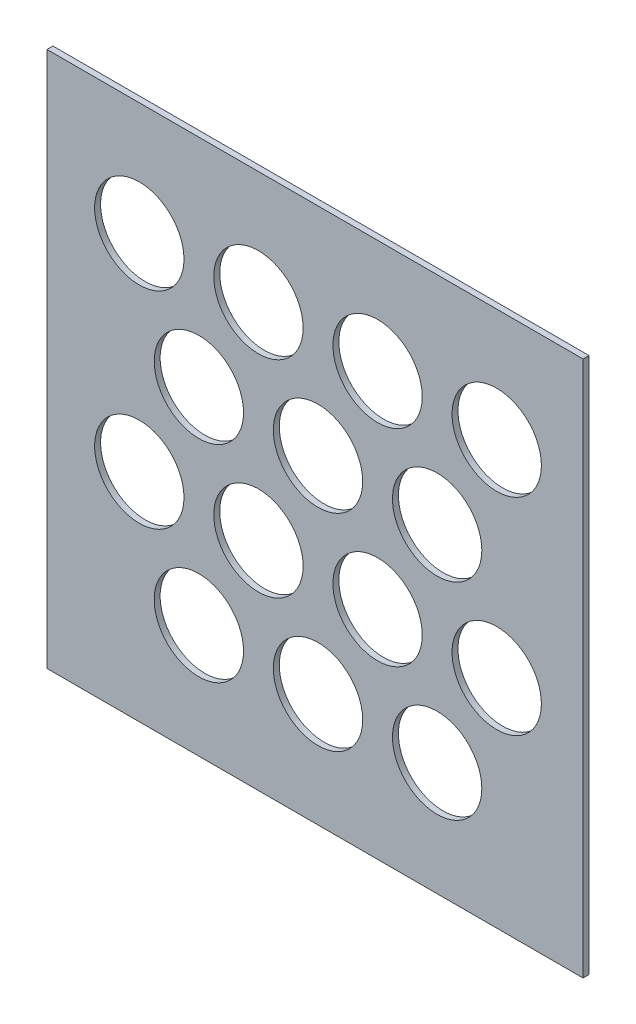
from build123d import *

# Parameters (mm, degrees)
SKETCH1_W               = 228.6
SKETCH1_H               = 228.6
BOSS_EXTRUDE1_DEPTH     = 2.54
SKETCH4_R               = 19.05
CUT_EXTRUDE2_DEPTH      = 378.179309613
FILL_PATTERN2_OUTLINE_R = 19.05
FILL_PATTERN2_DEPTH     = 2.54


# Read off the part's stored shape, not the designer's step: Fill Pattern2
with BuildPart() as part:
    # Sketch1 → Boss-Extrude1 (new body)
    with BuildSketch(Plane.XY):
        with Locations((-152.4, 152.4)):
            Rectangle(SKETCH1_W, SKETCH1_H)
    extrude(amount=BOSS_EXTRUDE1_DEPTH)

    # Sketch4 → Cut-Extrude2 (cut, through all)
    with BuildSketch(Plane.XY):
        with Locations((-227.33, 218.44)):
            Circle(SKETCH4_R)
    extrude(amount=CUT_EXTRUDE2_DEPTH, mode=Mode.SUBTRACT)

    # Fill Pattern2 outline → Fill Pattern2 (cut)
    with BuildSketch(Plane.XY):
        with Locations((-74.93, 130.451818976)):
            Circle(FILL_PATTERN2_OUTLINE_R)
        with Locations((-201.93, 86.457728463)):
            Circle(FILL_PATTERN2_OUTLINE_R)
        with Locations((-176.53, 218.44)):
            Circle(FILL_PATTERN2_OUTLINE_R)
        with Locations((-201.93, 174.445909488)):
            Circle(FILL_PATTERN2_OUTLINE_R)
        with Locations((-227.33, 130.451818976)):
            Circle(FILL_PATTERN2_OUTLINE_R)
        with Locations((-125.73, 130.451818976)):
            Circle(FILL_PATTERN2_OUTLINE_R)
        with Locations((-100.33, 174.445909488)):
            Circle(FILL_PATTERN2_OUTLINE_R)
        with Locations((-74.93, 218.44)):
            Circle(FILL_PATTERN2_OUTLINE_R)
        with Locations((-100.33, 86.457728463)):
            Circle(FILL_PATTERN2_OUTLINE_R)
        with Locations((-176.53, 130.451818976)):
            Circle(FILL_PATTERN2_OUTLINE_R)
        with Locations((-151.13, 174.445909488)):
            Circle(FILL_PATTERN2_OUTLINE_R)
        with Locations((-125.73, 218.44)):
            Circle(FILL_PATTERN2_OUTLINE_R)
        with Locations((-151.13, 86.457728463)):
            Circle(FILL_PATTERN2_OUTLINE_R)
    extrude(amount=FILL_PATTERN2_DEPTH, mode=Mode.SUBTRACT)


solid = part.part
